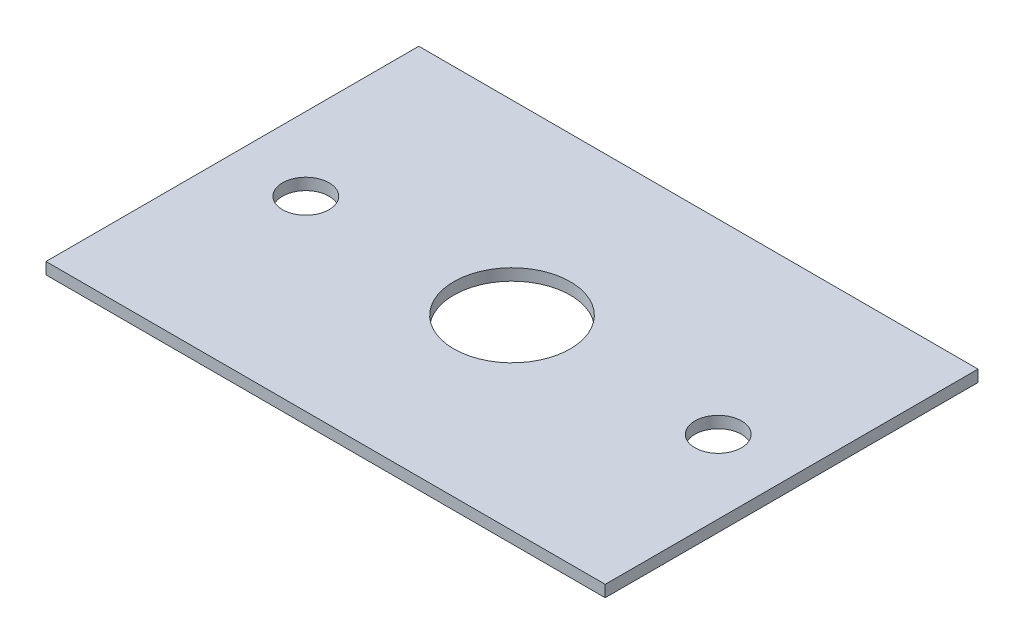
from build123d import *

# Parameters (mm, degrees)
SKETCH1_W           = 76.2
SKETCH1_H           = 50.8
SKETCH1_R           = 7.9375
SKETCH1_R_2         = 3.175
BOSS_EXTRUDE1_DEPTH = 1.5875


with BuildPart() as part:
    # Sketch1 → Boss-Extrude1 (new body)
    with BuildSketch(Plane(origin=(0, 0, 0), x_dir=(1, 0, 0), z_dir=(0, 1, 0))):
        Rectangle(SKETCH1_W, SKETCH1_H)
        Circle(SKETCH1_R, mode=Mode.SUBTRACT)
        with Locations((-28.1, 0)):
            Circle(SKETCH1_R_2, mode=Mode.SUBTRACT)
        with Locations((28.1, 0)):
            Circle(SKETCH1_R_2, mode=Mode.SUBTRACT)
    extrude(amount=BOSS_EXTRUDE1_DEPTH)


solid = part.part
